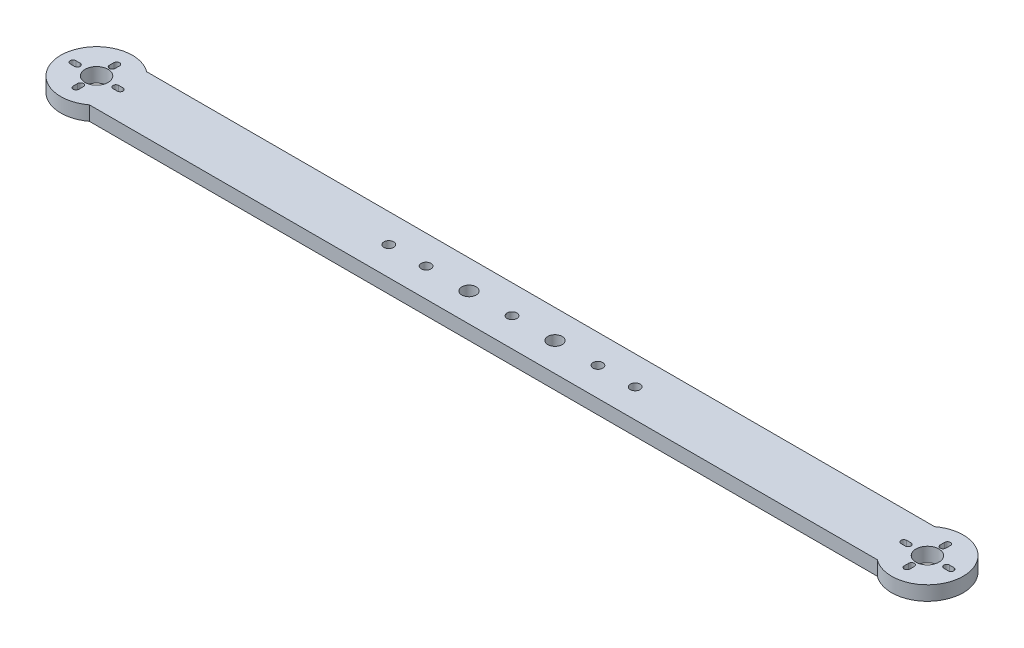
from build123d import *

# Parameters (mm, degrees)
BOSS_EXTRUDE1_DEPTH = 6.35
SKETCH2_R           = 5.08
CUT_EXTRUDE1_DEPTH  = 201.754423986
SKETCH3_R           = 2.159
CUT_EXTRUDE2_DEPTH  = 201.754423986
SKETCH4_R           = 3.175
CUT_EXTRUDE3_DEPTH  = 201.754423986
SKETCH6_R           = 2.159
CUT_EXTRUDE5_DEPTH  = 201.754423986


with BuildPart() as part:
    # Sketch1 → Boss-Extrude1 (new body)
    with BuildSketch(Plane(origin=(0, 0, 0), x_dir=(1, 0, 0), z_dir=(0, 1, 0))):
        with BuildLine():
            Line((-174.625, 12.7), (174.625, 12.7))
            ThreePointArc((174.625, 12.7), (200.025, 0), (174.625, -12.7))
            Line((174.625, -12.7), (-174.625, -12.7))
            ThreePointArc((-174.625, -12.7), (-200.025, 0), (-174.625, 12.7))
        make_face()
    extrude(amount=BOSS_EXTRUDE1_DEPTH)

    # Sketch2 → Cut-Extrude1 (cut, through all)
    with BuildSketch(Plane(origin=(0, 6.35, 0), x_dir=(1, 0, 0), z_dir=(0, 1, 0))):
        with Locations((184.15, 0)):
            Circle(SKETCH2_R)
        with Locations((-184.15, 0)):
            Circle(SKETCH2_R)
        with BuildLine():
            Line((173.691383345, 1.25), (175.608616655, 1.25))
            ThreePointArc((175.608616655, 1.25), (176.858616655, 0), (175.608616655, -1.25))
            Line((175.608616655, -1.25), (173.691383345, -1.25))
            ThreePointArc((173.691383345, -1.25), (172.441383345, 0), (173.691383345, 1.25))
        make_face()
        with BuildLine():
            Line((194.608616655, 1.25), (192.691383345, 1.25))
            ThreePointArc((192.691383345, 1.25), (191.441383345, 0), (192.691383345, -1.25))
            Line((192.691383345, -1.25), (194.608616655, -1.25))
            ThreePointArc((194.608616655, -1.25), (195.858616655, 0), (194.608616655, 1.25))
        make_face()
        with BuildLine():
            Line((185.4, 8.920928665), (185.4, 6.921035691))
            ThreePointArc((185.4, 6.921035691), (184.15, 5.671035691), (182.9, 6.921035691))
            Line((182.9, 6.921035691), (182.9, 8.920928665))
            ThreePointArc((182.9, 8.920928665), (184.15, 10.170928665), (185.4, 8.920928665))
        make_face()
        with BuildLine():
            Line((185.441381345, -9.078964309), (185.441381345, -7.078964309))
            ThreePointArc((185.441381345, -7.078964309), (184.191381345, -5.828964309), (182.941381345, -7.078964309))
            Line((182.941381345, -7.078964309), (182.941381345, -9.078964309))
            ThreePointArc((182.941381345, -9.078964309), (184.191381345, -10.328964309), (185.441381345, -9.078964309))
        make_face()
        with BuildLine():
            Line((-185.441381345, -9.078964309), (-185.441381345, -7.078964309))
            ThreePointArc((-185.441381345, -7.078964309), (-184.191381345, -5.828964309), (-182.941381345, -7.078964309))
            Line((-182.941381345, -7.078964309), (-182.941381345, -9.078964309))
            ThreePointArc((-182.941381345, -9.078964309), (-184.191381345, -10.328964309), (-185.441381345, -9.078964309))
        make_face()
        with BuildLine():
            Line((-185.4, 8.920928665), (-185.4, 6.921035691))
            ThreePointArc((-185.4, 6.921035691), (-184.15, 5.671035691), (-182.9, 6.921035691))
            Line((-182.9, 6.921035691), (-182.9, 8.920928665))
            ThreePointArc((-182.9, 8.920928665), (-184.15, 10.170928665), (-185.4, 8.920928665))
        make_face()
        with BuildLine():
            Line((-194.608616655, 1.25), (-192.691383345, 1.25))
            ThreePointArc((-192.691383345, 1.25), (-191.441383345, 0), (-192.691383345, -1.25))
            Line((-192.691383345, -1.25), (-194.608616655, -1.25))
            ThreePointArc((-194.608616655, -1.25), (-195.858616655, 0), (-194.608616655, 1.25))
        make_face()
        with BuildLine():
            Line((-173.691383345, 1.25), (-175.608616655, 1.25))
            ThreePointArc((-175.608616655, 1.25), (-176.858616655, 0), (-175.608616655, -1.25))
            Line((-175.608616655, -1.25), (-173.691383345, -1.25))
            ThreePointArc((-173.691383345, -1.25), (-172.441383345, 0), (-173.691383345, 1.25))
        make_face()
    extrude(amount=-CUT_EXTRUDE1_DEPTH, mode=Mode.SUBTRACT)

    # Sketch3 → Cut-Extrude2 (cut, through all)
    with BuildSketch(Plane(origin=(0, 6.35, 0), x_dir=(1, 0, 0), z_dir=(0, 1, 0))):
        Circle(SKETCH3_R)
        with Locations((38.1, 0)):
            Circle(SKETCH3_R)
        with Locations((-38.1, 0)):
            Circle(SKETCH3_R)
    extrude(amount=-CUT_EXTRUDE2_DEPTH, mode=Mode.SUBTRACT)

    # Sketch4 → Cut-Extrude3 (cut, through all)
    with BuildSketch(Plane(origin=(0, 6.35, 0), x_dir=(1, 0, 0), z_dir=(0, 1, 0))):
        with Locations((-19.05, 0)):
            Circle(SKETCH4_R)
        with Locations((19.05, 0)):
            Circle(SKETCH4_R)
    extrude(amount=-CUT_EXTRUDE3_DEPTH, mode=Mode.SUBTRACT)

    # Sketch6 → Cut-Extrude5 (cut, through all)
    with BuildSketch(Plane(origin=(0, 0, 0), x_dir=(-1, 0, 0), z_dir=(0, -1, 0))):
        with Locations((54.61, 1.2e-08)):
            Circle(SKETCH6_R)
        with Locations((-54.61, 0)):
            Circle(SKETCH6_R)
    extrude(amount=-CUT_EXTRUDE5_DEPTH, mode=Mode.SUBTRACT)


solid = part.part
